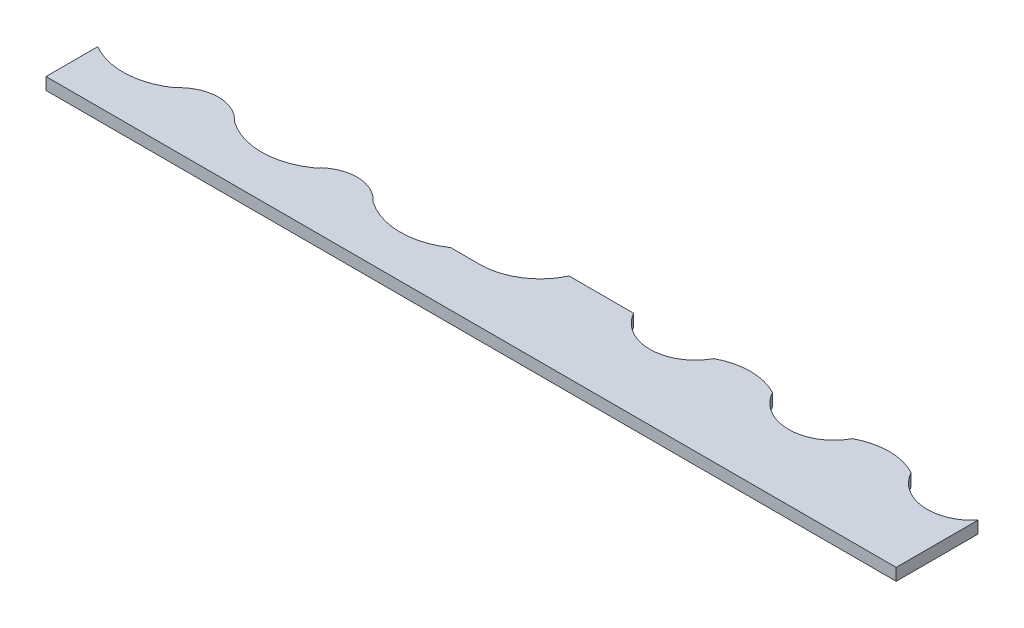
from build123d import *

# Parameters (mm, degrees)
BOSS_EXTRUDE1_DEPTH = 2
SKETCH3_W           = 150.539703927
SKETCH3_H           = 27.267854048
CUT_EXTRUDE2_DEPTH  = 2
FILLET2_R           = 10


with BuildPart() as part:
    # Sketch1 → Boss-Extrude1 (new body)
    with BuildSketch(Plane(origin=(0, 0, 0), x_dir=(1, 0, 0), z_dir=(0, 1, 0))):
        with BuildLine():
            Line((-52.137643745, -8.908278482), (-52.137643745, -18.874998482))
            Line((-52.137643745, -18.874998482), (89.612643745, -18.874998482))
            Line((89.612643745, -18.874998482), (89.612643745, -3.176759435))
            ThreePointArc((89.612643745, -3.176759435), (83.375, -7), (77.137356255, -3.176759435))
            ThreePointArc((77.137356255, -3.176759435), (71.9, -1.832537182), (66.662643745, -3.176759435))
            ThreePointArc((66.662643745, -3.176759435), (60.425, -7), (54.187356255, -3.176759435))
            ThreePointArc((54.187356255, -3.176759435), (48.95, -1.832537182), (43.712643745, -3.176759435))
            ThreePointArc((43.712643745, -3.176759435), (37.475, -7), (31.237356255, -3.176759435))
            Line((31.237356255, -3.176759435), (19.762356255, -3.176759435))
            Line((19.762356255, -3.176759435), (19.762356255, -8.908278482))
            Line((19.762356255, -8.908278482), (6.237643745, -8.908278482))
            ThreePointArc((6.237643745, -8.908278482), (0, -10.875), (-6.237643745, -8.908278482))
            ThreePointArc((-6.237643745, -8.908278482), (-11.475, -6.552640597), (-16.712356255, -8.908278482))
            ThreePointArc((-16.712356255, -8.908278482), (-22.95, -10.875), (-29.187643745, -8.908278482))
            ThreePointArc((-29.187643745, -8.908278482), (-34.425, -6.552640597), (-39.662356255, -8.908278482))
            ThreePointArc((-39.662356255, -8.908278482), (-45.9, -10.875), (-52.137643745, -8.908278482))
        make_face()
    extrude(amount=BOSS_EXTRUDE1_DEPTH)

    # Sketch3 → Cut-Extrude2 (cut)
    with BuildSketch(Plane(origin=(0, 2, 0), x_dir=(1, 0, 0), z_dir=(0, 1, 0))):
        with Locations((17.759945942, -9.959763718)):
            Rectangle(SKETCH3_W, SKETCH3_H)
        with BuildLine():
            Line((89.112643745, -18.374998482), (89.112643745, -4.83005634))
            ThreePointArc((89.112643745, -4.83005634), (82.598017349, -7.459644627), (76.765134062, -3.543962794))
            ThreePointArc((76.765134062, -3.543962794), (71.9, -2.332537182), (67.034865938, -3.543962794))
            ThreePointArc((67.034865938, -3.543962794), (60.425, -7.5), (53.815134062, -3.543962794))
            ThreePointArc((53.815134062, -3.543962794), (48.95, -2.332537182), (44.084865938, -3.543962794))
            ThreePointArc((44.084865938, -3.543962794), (37.550754129, -7.499617411), (30.938071053, -3.676759435))
            Line((30.938071053, -3.676759435), (20.262356255, -3.676759435))
            Line((20.262356255, -3.676759435), (20.262356255, -9.408278482))
            Line((20.262356255, -9.408278482), (6.393349749, -9.408278482))
            ThreePointArc((6.393349749, -9.408278482), (-0.109944429, -11.374468657), (-6.574017094, -9.282937264))
            ThreePointArc((-6.574017094, -9.282937264), (-11.475, -7.052640597), (-16.375982906, -9.282937264))
            ThreePointArc((-16.375982906, -9.282937264), (-22.95, -11.375), (-29.524017094, -9.282937264))
            ThreePointArc((-29.524017094, -9.282937264), (-34.425, -7.052640597), (-39.325982906, -9.282937264))
            ThreePointArc((-39.325982906, -9.282937264), (-45.402501157, -11.364115447), (-51.637643745, -9.821917799))
            Line((-51.637643745, -9.821917799), (-51.637643745, -18.374998482))
            Line((-51.637643745, -18.374998482), (89.112643745, -18.374998482))
        make_face(mode=Mode.SUBTRACT)
    extrude(amount=-CUT_EXTRUDE2_DEPTH, mode=Mode.SUBTRACT)

    # Fillet2
    # the kernel refuses this fillet: 10 mm, written as the material it adds along each edge
    with BuildSketch(Plane(origin=(20.262356255, 2, 9.408278482), x_dir=(-1, 0, 0), z_dir=(0, -1, 0))) as fillet2_piece_1:
        with BuildLine():
            CenterArc((9.043233401, 10), FILLET2_R, 205.267698006, 64.732301994)
            Line((0, 5.731519047), (-0.180864668, 5.646149428))
            ThreePointArc((-0.180864668, 5.646149428), (-0.2, 2.865759523), (-0.2, 0))
            Line((-0.2, 0), (0, -0.2))
            Line((0, -0.2), (9.043233401, -0.2))
            Line((9.043233401, -0.2), (9.043233401, 0))
        make_face()
    extrude(amount=2)


solid = part.part
